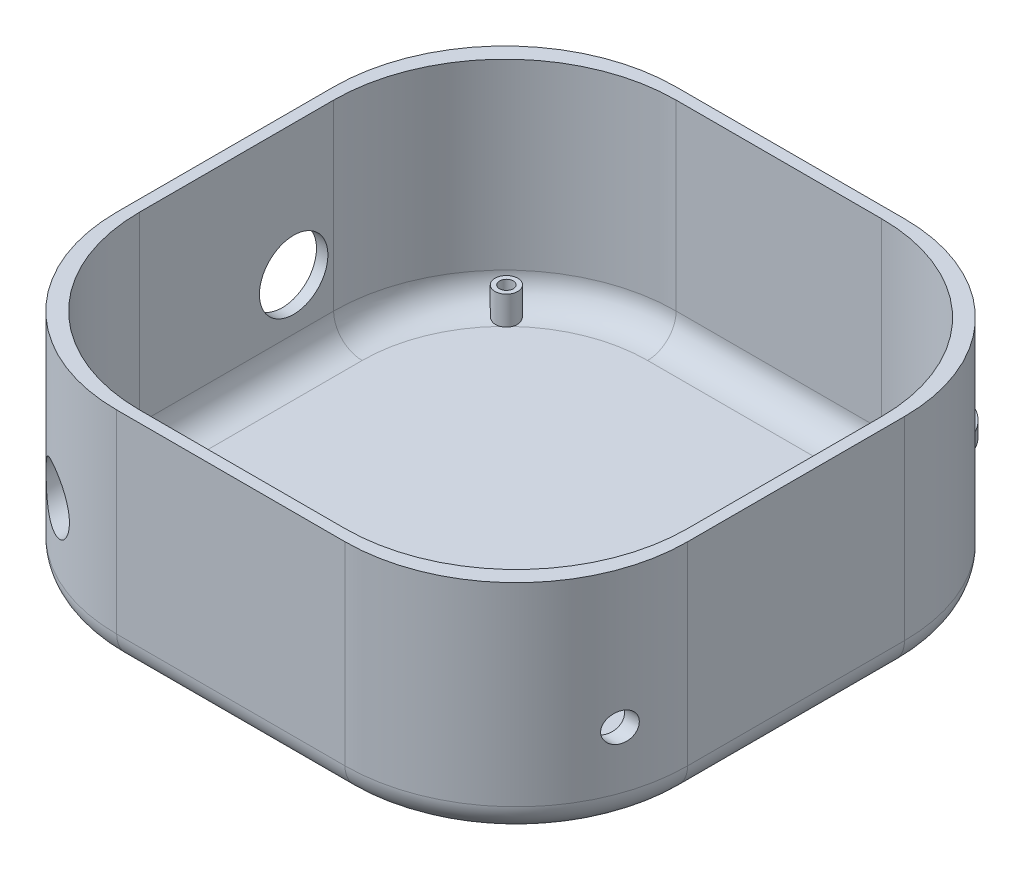
from build123d import *

# Parameters (mm, degrees)
BOSS_EXTRUDE1_DEPTH = 39
CUT_EXTRUDE1_START  = 2
CUT_EXTRUDE1_DEPTH  = 39
SKETCH1_4_R         = 2.0000000000000036
SKETCH1_4_R_2       = 1.2000000000000004
SKETCH1_4_R_3       = 2.0000000000000013
SKETCH1_4_R_4       = 1.1999999999999982
SKETCH1_4_R_5       = 2.0000000000000058
SKETCH1_4_R_6       = 1.2000000000000048
SKETCH1_4_R_7       = 1.9999999999999973
SKETCH1_4_R_8       = 1.1999999999999962
BOSS_EXTRUDE2_DEPTH = 7
BOSS_EXTRUDE3_DEPTH = 2.5
FILLET1_R           = 5
FILLET4_R           = 5
FILLET2_R           = 5
FILLET5_R           = 5
FILLET6_R           = 5
SKETCH2_R           = 5.999999999999995
CUT_EXTRUDE2_DEPTH  = 50
SKETCH2_4_R         = 2.4999999999999947
CUT_EXTRUDE5_DEPTH  = 50
SKETCH3_R           = 5.000000000000001
CUT_EXTRUDE6_DEPTH  = 50


with BuildPart() as part:
    # Sketch1 → Boss-Extrude1 (new body)
    with BuildSketch(Plane(origin=(0, 0, 0), x_dir=(1, 0, 0), z_dir=(0, 1, 0))):
        with BuildLine():
            Line((-19.999999999999797, -49.00000000000001), (19.999999999999787, -49.00000000000001))
            ThreePointArc((19.999999999999787, -49.00000000000001), (41.21320343559643, -40.213203435596434), (49.99999999999999, -18.999999999999797))
            Line((49.99999999999999, -18.999999999999797), (49.99999999999999, 18.999999999999783))
            ThreePointArc((49.99999999999999, 18.999999999999783), (41.21320343559643, 40.21320343559642), (19.999999999999787, 48.99999999999999))
            Line((19.999999999999787, 48.99999999999999), (-19.999999999999797, 48.99999999999999))
            ThreePointArc((-19.999999999999797, 48.99999999999999), (-41.21320343559644, 40.21320343559642), (-50.00000000000001, 18.999999999999783))
            Line((-50.00000000000001, 18.999999999999783), (-50.00000000000001, -18.999999999999797))
            ThreePointArc((-50.00000000000001, -18.999999999999797), (-41.21320343559644, -40.213203435596434), (-19.999999999999797, -49.00000000000001))
        make_face()
    extrude(amount=BOSS_EXTRUDE1_DEPTH)

    # Sketch1<3> → Cut-Extrude1 (cut)
    with BuildSketch(Plane(origin=(0, 0, 0), x_dir=(1, 0, 0), z_dir=(0, 1, 0)).offset(CUT_EXTRUDE1_START)):
        with BuildLine():
            Line((-17.999999999999805, -47), (17.999999999999776, -47))
            ThreePointArc((17.999999999999776, -47), (39.21320343559641, -38.21320343559643), (47.999999999999986, -16.99999999999979))
            Line((47.999999999999986, -16.99999999999979), (47.999999999999986, 16.99999999999979))
            ThreePointArc((47.999999999999986, 16.99999999999979), (39.21320343559641, 38.21320343559643), (17.999999999999776, 47))
            Line((17.999999999999776, 47), (-17.999999999999805, 47))
            ThreePointArc((-17.999999999999805, 47), (-39.21320343559644, 38.21320343559643), (-48.000000000000014, 16.99999999999979))
            Line((-48.000000000000014, 16.99999999999979), (-48.000000000000014, -16.99999999999979))
            ThreePointArc((-48.000000000000014, -16.99999999999979), (-39.21320343559644, -38.21320343559643), (-17.999999999999805, -47))
        make_face()
    extrude(amount=CUT_EXTRUDE1_DEPTH, mode=Mode.SUBTRACT)

    # Sketch1<4> → Boss-Extrude2 (add)
    # profile 1 of 4: a face of its own
    with BuildSketch(Plane(origin=(0, 0, 0), x_dir=(1, 0, 0), z_dir=(0, 1, 0))):
        with Locations(Location((-36.8433250242647, 36.10645852377939, 0), (0, 0, 270))):
            Circle(SKETCH1_4_R)
        with Locations(Location((-36.8433250242647, 36.10645852377939, 0), (0, 0, 270))):
            Circle(SKETCH1_4_R_2, mode=Mode.SUBTRACT)
    # profile 2 of 4: a face of its own
    with BuildSketch(Plane(origin=(0, 0, 0), x_dir=(1, 0, 0), z_dir=(0, 1, 0))):
        with Locations(Location((36.10645852377952, 36.84332502426459, 0), (0, 0, 270))):
            Circle(SKETCH1_4_R_3)
        with Locations(Location((36.10645852377952, 36.84332502426459, 0), (0, 0, 270))):
            Circle(SKETCH1_4_R_4, mode=Mode.SUBTRACT)
    # profile 3 of 4: a face of its own
    with BuildSketch(Plane(origin=(0, 0, 0), x_dir=(1, 0, 0), z_dir=(0, 1, 0))):
        with Locations(Location((36.843325024264445, -36.10645852377966, 0), (0, 0, 270))):
            Circle(SKETCH1_4_R_5)
        with Locations(Location((36.843325024264445, -36.10645852377966, 0), (0, 0, 270))):
            Circle(SKETCH1_4_R_6, mode=Mode.SUBTRACT)
    # profile 4 of 4: a face of its own
    with BuildSketch(Plane(origin=(0, 0, 0), x_dir=(1, 0, 0), z_dir=(0, 1, 0))):
        with Locations(Location((-36.106458523779764, -36.84332502426431, 0), (0, 0, 270))):
            Circle(SKETCH1_4_R_7)
        with Locations(Location((-36.106458523779764, -36.84332502426431, 0), (0, 0, 270))):
            Circle(SKETCH1_4_R_8, mode=Mode.SUBTRACT)
    extrude(amount=BOSS_EXTRUDE2_DEPTH)

    # Sketch1<5> → Boss-Extrude3 (add)
    with BuildSketch(Plane(origin=(0, 0, 0), x_dir=(1, 0, 0), z_dir=(0, 1, 0))):
        with BuildLine():
            Line((-18.154159836328176, 55.16128494414829), (-18.154159836328176, 48.88483957639632))
            Line((-18.154159836328176, 48.88483957639632), (-23.096119979680363, 48.83980631759234))
            Line((-23.096119979680363, 48.83980631759234), (-23.096119979680363, 55.16128494414829))
            ThreePointArc((-23.096119979680363, 55.16128494414829), (-14.306274266743912, 63.95113065708475), (-5.516428553807461, 55.16128494414829))
            Line((-5.516428553807461, 55.16128494414829), (-5.516428553807461, 48.99999999999999))
            Line((-5.516428553807461, 48.99999999999999), (-10.458388697159648, 48.95496674119602))
            Line((-10.458388697159648, 48.95496674119602), (-10.458388697159648, 48.99999999999999))
            Line((-10.458388697159648, 48.99999999999999), (-10.458388697159648, 55.16128494414829))
            ThreePointArc((-10.458388697159648, 55.16128494414829), (-14.306274266743912, 59.009170513732556), (-18.154159836328176, 55.16128494414829))
        make_face()
        with BuildLine():
            Line((5.5164285538074465, 55.16128494414829), (5.5164285538074465, 48.99999999999999))
            Line((5.5164285538074465, 48.99999999999999), (10.458388697159634, 48.95496674119602))
            Line((10.458388697159634, 48.95496674119602), (10.458388697159634, 48.99999999999999))
            Line((10.458388697159634, 48.99999999999999), (10.458388697159634, 55.16128494414829))
            ThreePointArc((10.458388697159634, 55.16128494414829), (14.306274266743898, 59.009170513732556), (18.154159836328162, 55.16128494414829))
            Line((18.154159836328162, 55.16128494414829), (18.154159836328162, 48.88483957639632))
            Line((18.154159836328162, 48.88483957639632), (23.09611997968035, 48.83980631759234))
            Line((23.09611997968035, 48.83980631759234), (23.09611997968035, 55.16128494414829))
            ThreePointArc((23.09611997968035, 55.16128494414829), (14.306274266743898, 63.95113065708475), (5.5164285538074465, 55.16128494414829))
        make_face()
    extrude(amount=BOSS_EXTRUDE3_DEPTH)

    # Fillet1
    # the kernel refuses this fillet: 5 mm, written as the material it adds along each edge
    with BuildSketch(Plane(origin=(17.999999999999975, 2, 16.99999999999999), x_dir=(-6.63e-15, 0, 1), z_dir=(-1, 0, -6.63e-15))) as fillet1_piece_1_section:
        with BuildLine():
            CenterArc((30.00000000000001 - FILLET1_R, FILLET1_R), FILLET1_R, 270, 90)
            Line((30.00000000000001 - FILLET1_R, -8.9e-16), (30.00000000000001, 0))
            Line((30.00000000000001, 0), (30.00000000000001, FILLET1_R))
        make_face()
    fillet1_piece_1 = revolve(axis=Axis((17.999999999999975, 2, 16.99999999999999), (0, 1, 0)), revolution_arc=90.00000000000077, mode=Mode.PRIVATE)
    fillet1_piece_1 = fillet1_piece_1 - Plane(origin=(36.843325024264445, 5.6898812741854545, 36.10645852377966), x_dir=(-1.8e-16, 0, 1), z_dir=(0, -1, 0)) * Cylinder(1.2000000000000048, 121, mode=Mode.PRIVATE)
    add(fillet1_piece_1)
    with BuildSketch(Plane(origin=(47.999999999999986, 2, 16.99999999999979), x_dir=(0, 1, 0), z_dir=(0, 0, -1)), Plane(origin=(-48.000000000000014, 2, -16.99999999999979), x_dir=(0, 1, 0), z_dir=(0, 0, 1))) as fillet1_piece_2:
        with BuildLine():
            CenterArc((FILLET1_R, -FILLET1_R), FILLET1_R, 90, 90)
            Line((-8.9e-16, -FILLET1_R), (0, 0))
            Line((0, 0), (FILLET1_R, 0))
        make_face()
    extrude(amount=33.99999999999958)
    with BuildSketch(Plane(origin=(17.999999999999975, 2, -16.99999999999999), x_dir=(1, 0, 6.63e-15), z_dir=(-6.63e-15, 0, 1))) as fillet1_piece_3_section:
        with BuildLine():
            CenterArc((30.00000000000001 - FILLET1_R, FILLET1_R), FILLET1_R, 270, 90)
            Line((30.00000000000001 - FILLET1_R, -8.9e-16), (30.00000000000001, 0))
            Line((30.00000000000001, 0), (30.00000000000001, FILLET1_R))
        make_face()
    fillet1_piece_3 = revolve(axis=Axis((17.999999999999975, 2, -16.99999999999999), (0, 1, 0)), revolution_arc=90.00000000000077, mode=Mode.PRIVATE)
    fillet1_piece_3 = fillet1_piece_3 - Plane(origin=(36.10645852377952, 3.4206984478299667, -36.84332502426459), x_dir=(-1.8e-16, 0, 1), z_dir=(0, -1, 0)) * Cylinder(1.1999999999999982, 121, mode=Mode.PRIVATE)
    add(fillet1_piece_3)
    with BuildSketch(Plane(origin=(-17.999999999999805, 2, 47), x_dir=(0, 1, 0), z_dir=(1, 0, 0)), Plane(origin=(17.999999999999776, 2, -47), x_dir=(0, 1, 0), z_dir=(-1, 0, 0))) as fillet1_piece_4:
        with BuildLine():
            CenterArc((FILLET1_R, -FILLET1_R), FILLET1_R, 90, 90)
            Line((-8.9e-16, -FILLET1_R), (0, 0))
            Line((0, 0), (FILLET1_R, 0))
        make_face()
    extrude(amount=35.99999999999958)
    with BuildSketch(Plane(origin=(-18.000000000000004, 2, 16.99999999999999), x_dir=(-1, 0, -6.63e-15), z_dir=(6.63e-15, 0, -1))) as fillet1_piece_5_section:
        with BuildLine():
            CenterArc((30.00000000000001 - FILLET1_R, FILLET1_R), FILLET1_R, 270, 90)
            Line((30.00000000000001 - FILLET1_R, -8.9e-16), (30.00000000000001, 0))
            Line((30.00000000000001, 0), (30.00000000000001, FILLET1_R))
        make_face()
    fillet1_piece_5 = revolve(axis=Axis((-18.000000000000004, 2, 16.99999999999999), (0, 1, 0)), revolution_arc=90.00000000000077, mode=Mode.PRIVATE)
    fillet1_piece_5 = fillet1_piece_5 - Plane(origin=(-36.106458523779764, 3.4206984171784653, 36.84332502426431), x_dir=(-1.8e-16, 0, 1), z_dir=(0, -1, 0)) * Cylinder(1.1999999999999962, 121, mode=Mode.PRIVATE)
    add(fillet1_piece_5)
    with BuildSketch(Plane(origin=(-18.000000000000004, 2, -16.99999999999999), x_dir=(6.63e-15, 0, -1), z_dir=(1, 0, 6.63e-15))) as fillet1_piece_6_section:
        with BuildLine():
            CenterArc((30.00000000000001 - FILLET1_R, FILLET1_R), FILLET1_R, 270, 90)
            Line((30.00000000000001 - FILLET1_R, -8.9e-16), (30.00000000000001, 0))
            Line((30.00000000000001, 0), (30.00000000000001, FILLET1_R))
        make_face()
    fillet1_piece_6 = revolve(axis=Axis((-18.000000000000004, 2, -16.99999999999999), (0, 1, 0)), revolution_arc=90.00000000000077, mode=Mode.PRIVATE)
    fillet1_piece_6 = fillet1_piece_6 - Plane(origin=(-36.8433250242647, 5.689881272966079, -36.10645852377939), x_dir=(-1.8e-16, 0, 1), z_dir=(0, -1, 0)) * Cylinder(1.2000000000000004, 121, mode=Mode.PRIVATE)
    add(fillet1_piece_6)

    # Fillet4
    fillet4_edges = [part.edges().sort_by_distance(p)[0] for p in [
        (-19.07707991816399, 2.5, -48.99999999999999),
        (21.550130715815428, 2.5, -48.959924812387044),
        (19.077079918163975, 2.5, -48.99999999999999),
        (-21.55013071581545, 2.5, -48.959924812387044),
    ]]
    fillet(fillet4_edges, radius=FILLET4_R)

    # Fillet2
    fillet2_edges = [part.edges().sort_by_distance(p)[0] for p in [
        (42.28097393955677, 0, -39.088758057799176),
        (-42.280973939556795, 0, -39.088758057799176),
        (-50.00000000000001, 0, 7.11e-15),
        (-41.213203435596434, 0, 40.21320343559644),
        (-3.55e-15, 0, 49.00000000000001),
        (41.21320343559643, 0, 40.21320343559644),
        (49.99999999999999, 0, 7.11e-15),
    ]]
    fillet(fillet2_edges, radius=FILLET2_R)

    # Fillet5
    fillet5_edges = [part.edges().sort_by_distance(p)[0] for p in [
        (-7.987408625483553, 2.5, -48.99999999999999),
        (7.987408625483539, 2.5, -48.99999999999999),
    ]]
    fillet(fillet5_edges, radius=FILLET5_R)

    # Fillet6
    fillet6_edges = [part.edges().sort_by_distance(p)[0] for p in [
        (14.306274266743898, 0, -48.99999999999999),
        (-14.306274266743912, 0, -48.99999999999999),
        (-7.11e-15, 0, -48.99999999999999),
    ]]
    fillet(fillet6_edges, radius=FILLET6_R)

    # Sketch2 → Cut-Extrude2 (cut)
    with BuildSketch(Plane(origin=(0, 0, 0), x_dir=(0, 0, -1), z_dir=(1, 0, 0))):
        with Locations((9.999999999999998, 16)):
            Circle(SKETCH2_R)
    extrude(amount=-CUT_EXTRUDE2_DEPTH, mode=Mode.SUBTRACT)

    # Sketch2<4> → Cut-Extrude5 (cut)
    with BuildSketch(Plane(origin=(0, 0, 0), x_dir=(0, 0, -1), z_dir=(1, 0, 0))):
        with Locations(Location((-29, 15, 0), (0, 0, 180))):
            Circle(SKETCH2_4_R)
    extrude(amount=CUT_EXTRUDE5_DEPTH, mode=Mode.SUBTRACT)

    # Sketch3 → Cut-Extrude6 (cut)
    with BuildSketch(Plane.XY):
        with Locations(Location((-35, 16, 0), (0, 0, 180))):
            Circle(SKETCH3_R)
    extrude(amount=CUT_EXTRUDE6_DEPTH, mode=Mode.SUBTRACT)


solid = part.part
